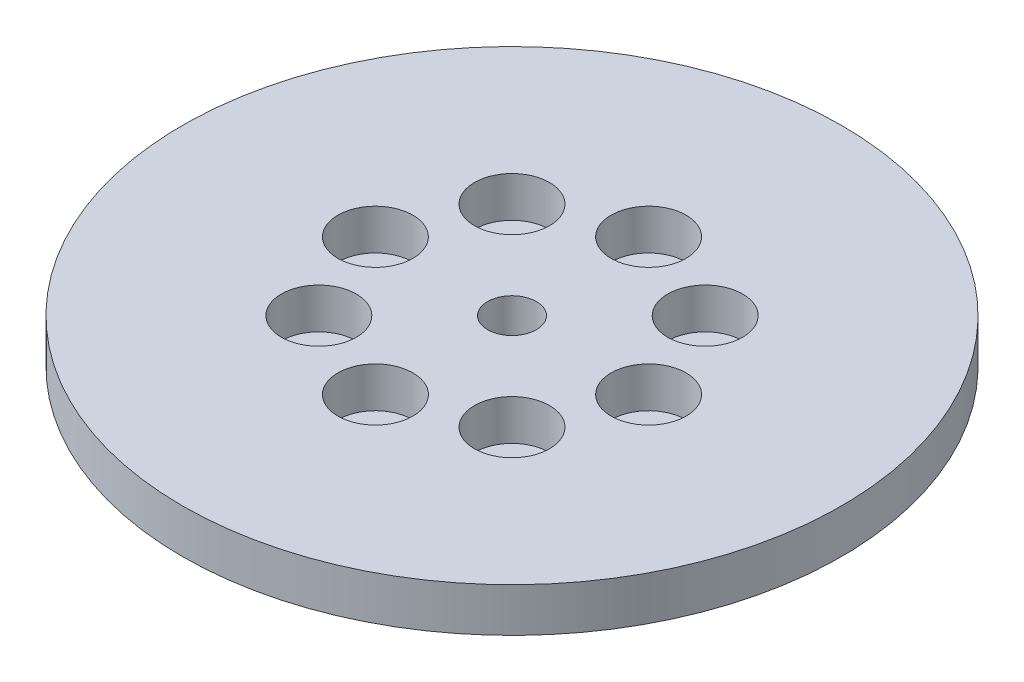
from build123d import *

# Parameters (mm, degrees)
SKETCH1_R           = 67.5
BOSS_EXTRUDE1_DEPTH = 9
SKETCH2_R           = 5
CUT_EXTRUDE1_DEPTH  = 96.882740887
SKETCH3_R           = 7.67761536
CUT_EXTRUDE2_DEPTH  = 8.305058356
CIRPATTERN1_COUNT   = 8


with BuildPart() as part:
    # Sketch1 → Boss-Extrude1 (new body)
    with BuildSketch(Plane(origin=(0, 0, 0), x_dir=(1, 0, 0), z_dir=(0, 1, 0))):
        Circle(SKETCH1_R)
    extrude(amount=BOSS_EXTRUDE1_DEPTH)

    # Sketch2 → Cut-Extrude1 (cut, through all)
    with BuildSketch(Plane(origin=(0, 0, 0), x_dir=(1, 0, 0), z_dir=(0, 1, 0))):
        Circle(SKETCH2_R)
    extrude(amount=CUT_EXTRUDE1_DEPTH, mode=Mode.SUBTRACT)

    # Sketch3 → Cut-Extrude2 (cut)
    with BuildSketch(Plane(origin=(0, 9, 0), x_dir=(1, 0, 0), z_dir=(0, 1, 0))):
        with Locations((-27.977705151, 0)):
            Circle(SKETCH3_R)
    cut_extrude2 = extrude(amount=-CUT_EXTRUDE2_DEPTH, mode=Mode.SUBTRACT)

    # CirPattern1: Cut-Extrude2 ×8 about axis
    cirpattern1_axis = Axis((0, 0, 0), (0, 1, 0))
    for i in range(1, CIRPATTERN1_COUNT):
        add(cut_extrude2.rotate(cirpattern1_axis, i * 360 / CIRPATTERN1_COUNT), mode=Mode.SUBTRACT)


solid = part.part
